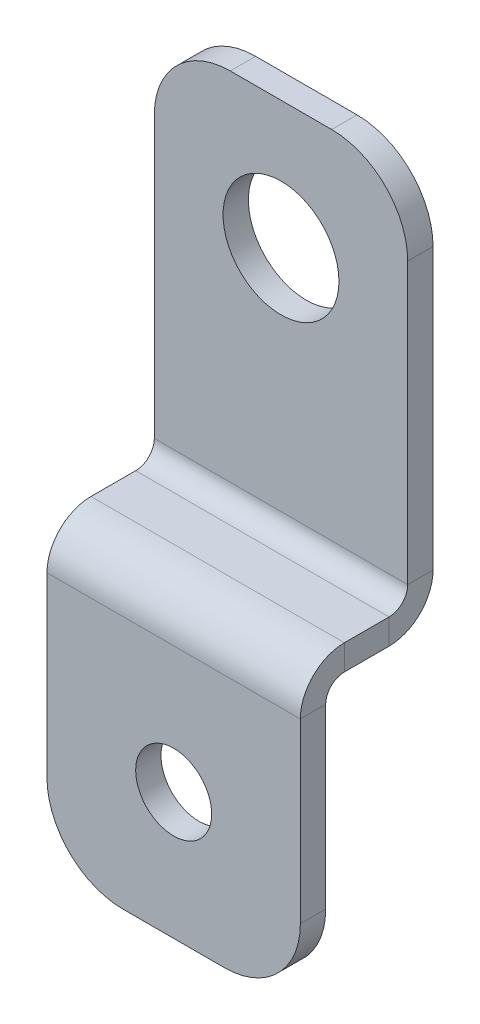
from build123d import *

# Parameters (mm, degrees)
SKETCH1_W          = 10
SKETCH1_H          = 14.057527786
SKETCH1_R          = 2.287307526
BASE_FLANGE1_DEPTH = 1
EDGE_FLANGE1_DEPTH = 10
EDGE_FLANGE2_DEPTH = 10
SKETCH12_R         = 1.5
CUT_EXTRUDE1_DEPTH = 2
FILLET1_R          = 3


# Sheet-metal steps are written as plain solids
with BuildPart() as part:
    # Sketch1 → Base-Flange1 (new body)
    with BuildSketch(Plane.XY):
        with Locations((-509.974194853, -21.379047402)):
            Rectangle(SKETCH1_W, SKETCH1_H)
        with Locations((-509.974194853, -19.4)):
            Circle(SKETCH1_R, mode=Mode.SUBTRACT)
    extrude(amount=BASE_FLANGE1_DEPTH)

    # Edge-Flange1 section (across the edge) → Edge-Flange1 (add)
    with BuildSketch(Plane(origin=(-514.974194853, -29.144411295, 1), x_dir=(0, 1, 0), z_dir=(1, 0, 0))):
        with BuildLine():
            Line((-1, 0.7366), (-1, 2.5))
            Line((-1, 2.5), (0, 2.5))
            Line((0, 2.5), (0, 0.7366))
            ThreePointArc((0, 0.7366), (0.215745145, 0.215745145), (0.7366, 0))
            Line((0.7366, 0), (0.7366, -1))
            ThreePointArc((0.7366, -1), (-0.491361636, -0.491361636), (-1, 0.7366))
        make_face()
    extrude(amount=EDGE_FLANGE1_DEPTH)

    # Edge-Flange2 section (across the edge) → Edge-Flange2 (add)
    with BuildSketch(Plane(origin=(-504.974194853, -30.144411295, 4.2366), x_dir=(0, 0, -1), z_dir=(-1, 0, 0))):
        with BuildLine():
            Line((-1, 0.7366), (-1, 10.7366))
            Line((-1, 10.7366), (0, 10.7366))
            Line((0, 10.7366), (0, 0.7366))
            ThreePointArc((0, 0.7366), (0.215745145, 0.215745145), (0.7366, 0))
            Line((0.7366, 0), (0.7366, -1))
            ThreePointArc((0.7366, -1), (-0.491361636, -0.491361636), (-1, 0.7366))
        make_face()
    extrude(amount=EDGE_FLANGE2_DEPTH)

    # Sketch12 → Cut-Extrude1 (cut)
    with BuildSketch(Plane(origin=(0, 0, 4.2366), x_dir=(-1, 0, 0), z_dir=(0, 0, -1))):
        with Locations((509.974194853, -35.881011295)):
            Circle(SKETCH12_R)
    extrude(amount=-CUT_EXTRUDE1_DEPTH, mode=Mode.SUBTRACT)

    # Fillet1
    fillet1_edges = [part.edges().sort_by_distance(p)[0] for p in [
        (-504.974194853, -40.881011295, 4.7366),
        (-514.974194853, -40.881011295, 4.7366),
        (-514.974194853, -14.350283509, 0.5),
        (-504.974194853, -14.350283509, 0.5),
    ]]
    fillet(fillet1_edges, radius=FILLET1_R)


solid = part.part
